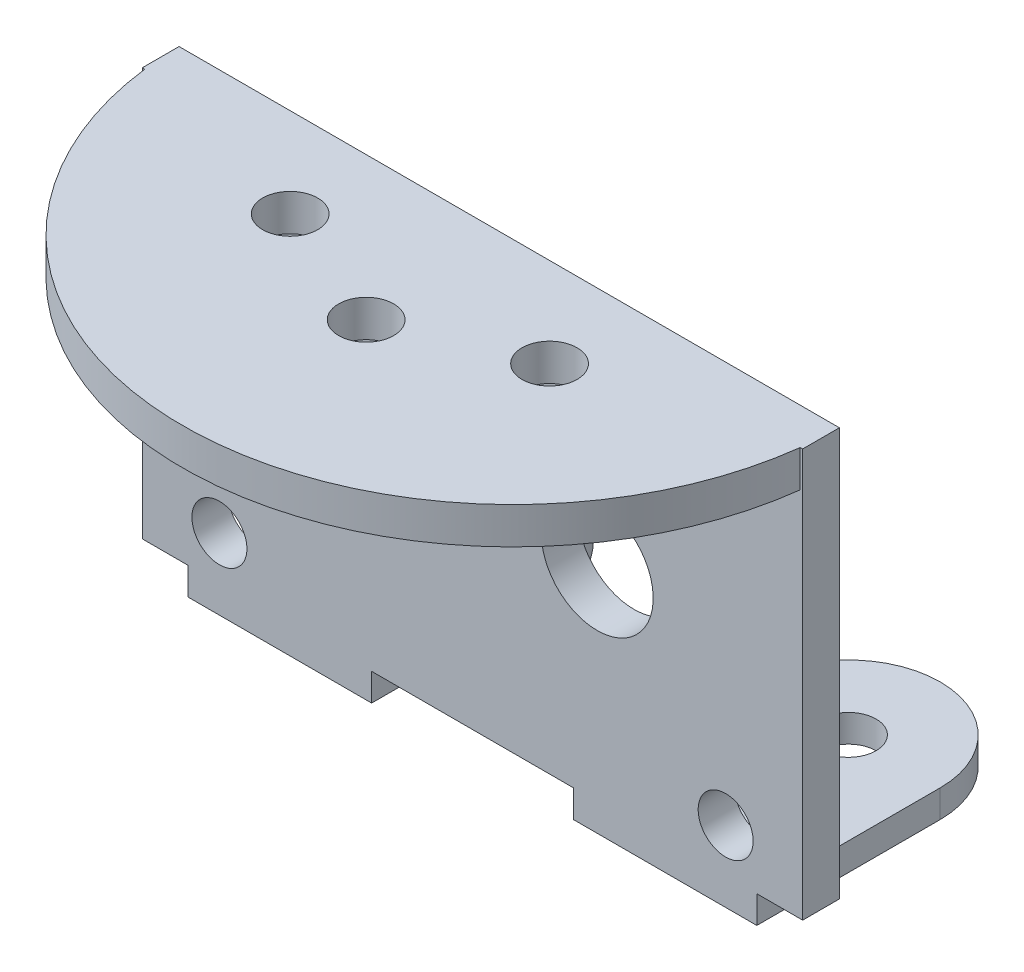
from build123d import *

# Parameters (mm, degrees)
CROQUIS1_W              = 36
CROQUIS1_H              = 22.25
CROQUIS1_R              = 1.5
CROQUIS1_R_2            = 3.05
CROQUIS1_R_3            = 1.875
SALIENTE_EXTRUIR1_DEPTH = 2
CROQUIS2_R              = 1.5
SALIENTE_EXTRUIR2_DEPTH = 1.5
CROQUIS3_R              = 1.5
CROQUIS3_R_2            = 1.500000001
SALIENTE_EXTRUIR6_DEPTH = 2


with BuildPart() as part:
    # Croquis1 → Saliente-Extruir1 (new body)
    with BuildSketch(Plane.XY):
        Rectangle(CROQUIS1_W, CROQUIS1_H)
        with Locations((13.8, 8.745)):
            Circle(CROQUIS1_R, mode=Mode.SUBTRACT)
        with Locations((13.8, -8.745)):
            Circle(CROQUIS1_R, mode=Mode.SUBTRACT)
        with Locations((6.8, 0)):
            Circle(CROQUIS1_R_2, mode=Mode.SUBTRACT)
        with Locations((-13.8, -8.745)):
            Circle(CROQUIS1_R, mode=Mode.SUBTRACT)
        with Locations((-13.8, 8.745)):
            Circle(CROQUIS1_R, mode=Mode.SUBTRACT)
        with Locations((-4.2, 0)):
            Circle(CROQUIS1_R_3, mode=Mode.SUBTRACT)
    extrude(amount=SALIENTE_EXTRUIR1_DEPTH)

    # Croquis2 → Saliente-Extruir2 (add)
    # profile 1 of 2: a face of its own
    with BuildSketch(Plane.XZ.offset(11.125)):
        with BuildLine():
            Line((5.5, 2), (5.5, -8))
            ThreePointArc((5.5, -8), (10.5, -13), (15.5, -8))
            Line((15.5, -8), (15.5, 2))
            Line((15.5, 2), (5.5, 2))
        make_face()
        with Locations((10.5, -8)):
            Circle(CROQUIS2_R, mode=Mode.SUBTRACT)
    # profile 2 of 2: a face of its own
    with BuildSketch(Plane.XZ.offset(11.125)):
        with BuildLine():
            Line((-5.5, -8), (-5.5, 2))
            Line((-5.5, 2), (-15.5, 2))
            Line((-15.5, 2), (-15.5, -8))
            ThreePointArc((-15.5, -8), (-10.5, -13), (-5.5, -8))
        make_face()
        with Locations((-10.5, -8)):
            Circle(CROQUIS2_R, mode=Mode.SUBTRACT)
    extrude(amount=SALIENTE_EXTRUIR2_DEPTH)

    # Croquis3 → Saliente-Extruir6 (add)
    with BuildSketch(Plane(origin=(0, 11.125, 0), x_dir=(1, 0, 0), z_dir=(0, 1, 0))):
        with BuildLine():
            Line((17.998888855, 0), (-17.998888855, 0))
            ThreePointArc((-17.998888855, 0), (0, -17.8), (17.998888855, 0))
        make_face()
        with Locations((7.071067812, -4.871067812)):
            Circle(CROQUIS3_R, mode=Mode.SUBTRACT)
        with Locations((-7.071067812, -4.871067812)):
            Circle(CROQUIS3_R_2, mode=Mode.SUBTRACT)
        with Locations((0, -7.8)):
            Circle(CROQUIS3_R, mode=Mode.SUBTRACT)
    extrude(amount=-SALIENTE_EXTRUIR6_DEPTH)


solid = part.part
